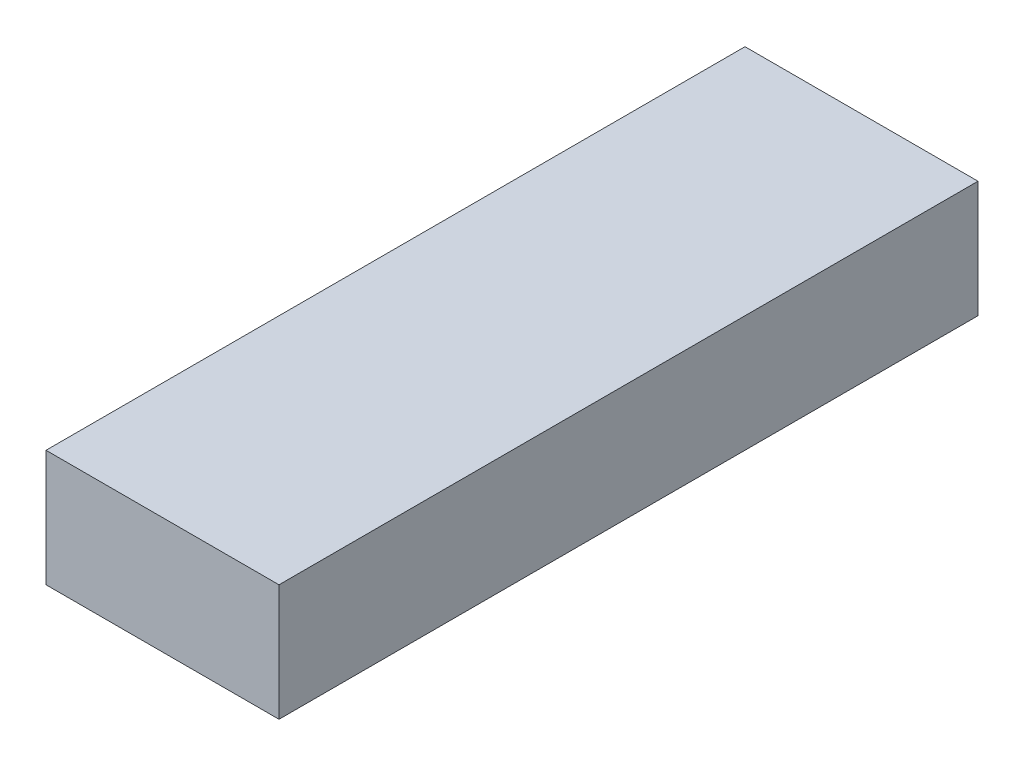
from build123d import *

# Parameters (mm, degrees)
SKETCH1_W           = 50.8
SKETCH1_H           = 25.4
BOSS_EXTRUDE1_DEPTH = 152.4


with BuildPart() as part:
    # Sketch1 → Boss-Extrude1 (new body)
    with BuildSketch(Plane.XY):
        Rectangle(SKETCH1_W, SKETCH1_H)
    extrude(amount=BOSS_EXTRUDE1_DEPTH)


solid = part.part
